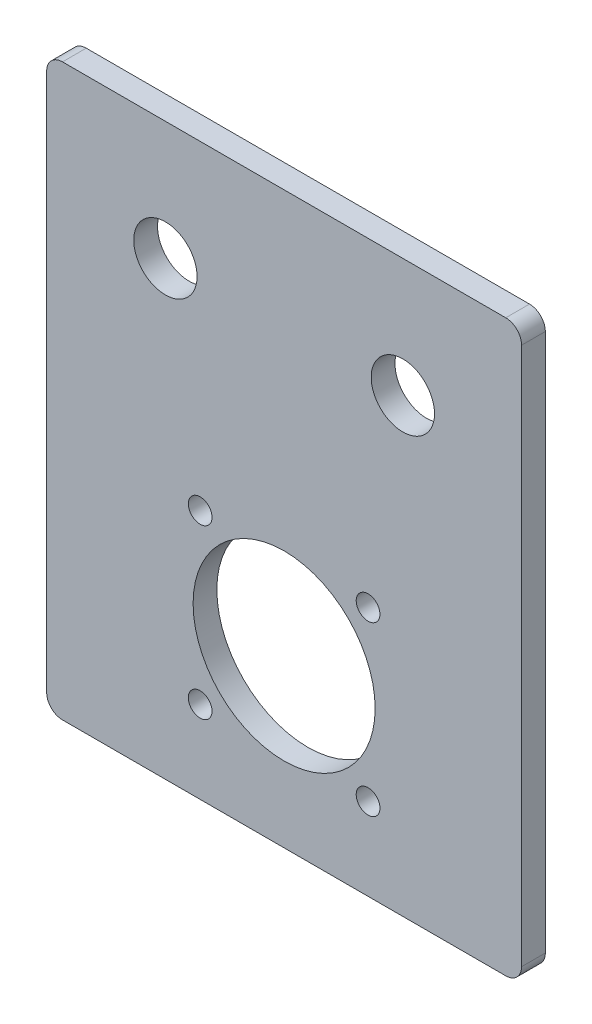
from build123d import *

# Parameters (mm, degrees)
SKETCH_1_W          = 60
SKETCH_1_H          = 72
EXTRUDE_1_DEPTH     = 3
SKETCH_2_R          = 11.5
SKETCH_2_R_2        = 1.5
SKETCH_2_R_3        = 4
CUT_EXTRUDE_1_DEPTH = 94.770997649
FILLET_1_R          = 2


with BuildPart() as part:
    # 草图1 → 凸台-拉伸1 (new body)
    with BuildSketch(Plane.XY):
        with Locations((30, 36)):
            Rectangle(SKETCH_1_W, SKETCH_1_H)
    extrude(amount=EXTRUDE_1_DEPTH)

    # 草图2 → 切除-拉伸1 (cut, through all)
    with BuildSketch(Plane.XY.offset(3)):
        with Locations((30, 21)):
            Circle(SKETCH_2_R)
        with Locations((19.393398282, 31.606601718)):
            Circle(SKETCH_2_R_2)
        with Locations((40.606601718, 31.606601718)):
            Circle(SKETCH_2_R_2)
        with Locations((40.606601718, 10.393398282)):
            Circle(SKETCH_2_R_2)
        with Locations((19.393398282, 10.393398282)):
            Circle(SKETCH_2_R_2)
        with Locations((15, 57)):
            Circle(SKETCH_2_R_3)
        with Locations((45, 57)):
            Circle(SKETCH_2_R_3)
    extrude(amount=-CUT_EXTRUDE_1_DEPTH, mode=Mode.SUBTRACT)

    # 圆角1
    fillet_1_edges = [part.edges().sort_by_distance(p)[0] for p in [
        (0, 72, 1.5),
        (60, 72, 1.5),
        (60, 0, 1.5),
        (0, 0, 1.5),
    ]]
    fillet(fillet_1_edges, radius=FILLET_1_R)


solid = part.part
